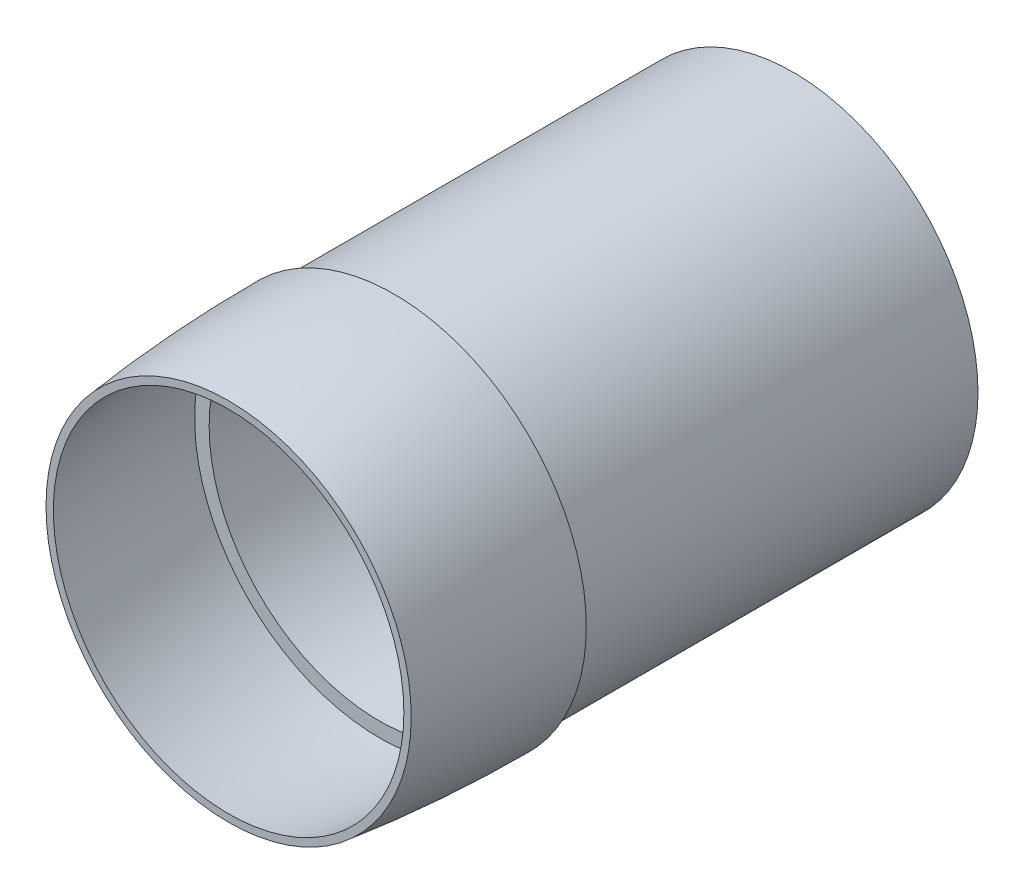
from build123d import *


with BuildPart() as part:
    # Sketch1 → Revolve1 (revolve)
    with BuildSketch(Plane(origin=(0, 0, 0), x_dir=(0, 0, -1), z_dir=(1, 0, 0))):
        with BuildLine():
            Line((0, 291.890243902), (0, 293.390243902))
            ThreePointArc((0, 293.390243902), (-17.02870714, 292.89564413), (-34, 291.413512413))
            Line((-34, 291.413512413), (-34, 289.90328471))
            ThreePointArc((-34, 289.90328471), (-18.526244749, 291.301721143), (-3, 291.874826742))
            Line((-3, 291.874826742), (-3, 288.890243902))
            Line((-3, 288.890243902), (79, 288.890243902))
            Line((79, 288.890243902), (79, 253.890243902))
            Line((79, 253.890243902), (82, 253.890243902))
            Line((82, 253.890243902), (82, 291.890243902))
            Line((82, 291.890243902), (0, 291.890243902))
        make_face()
    revolve(axis=Axis((0, 253.890243902, -79), (0, 0, -1)))


solid = part.part
